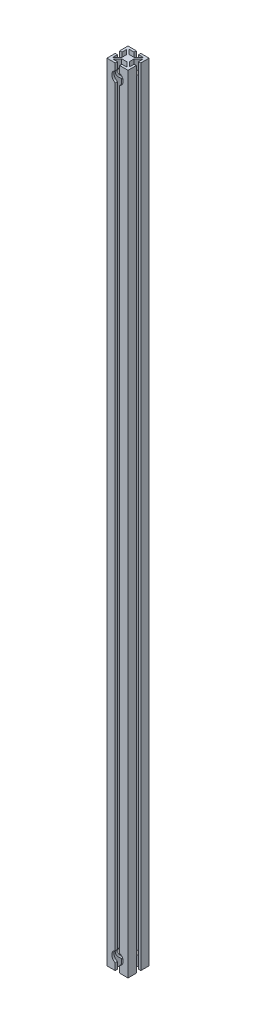
from build123d import *

# Parameters (mm, degrees)
EXTRUDE1_DEPTH          = 1422.4
SKETCH2_R               = 10.3124
CUT_EXTRUDE1_DEPTH      = 16.51
MIRROR2_COPY_1_SKETCH_R = 10.3124
MIRROR2_COPY_1_DEPTH    = 16.51


# Read off the part's stored shape, not the designer's step: 1515<1>
with BuildPart() as part:
    # Sketch1<2> → Extrude1 (new body)
    with BuildSketch(Plane(origin=(0, 0, 0), x_dir=(1, 0, 0), z_dir=(0, 1, 0))):
        Polygon((-6.7564, 4.364749804), (-6.7564, -4.364749804), (-14.986, -12.594349804), (-14.986, -4.064), (-19.05, -4.064), (-19.05, -19.05), (-4.064, -19.05), (-4.064, -14.986), (-13.067127258, -14.986), (-4.837527258, -6.7564), (4.837527258, -6.7564), (13.067127258, -14.986), (4.064, -14.986), (4.064, -19.05), (19.05, -19.05), (19.05, -4.064), (14.986, -4.064), (14.986, -12.594349804), (6.7564, -4.364749804), (6.7564, 4.364749804), (14.986, 12.594349804), (14.986, 4.064), (19.05, 4.064), (19.05, 19.05), (4.064, 19.05), (4.064, 14.986), (13.067127258, 14.986), (4.837527258, 6.7564), (-4.837527258, 6.7564), (-13.067127258, 14.986), (-4.064, 14.986), (-4.064, 19.05), (-19.05, 19.05), (-19.05, 4.064), (-14.986, 4.064), (-14.986, 12.594349804), align=None)
    extrude(amount=EXTRUDE1_DEPTH)

    # Sketch2 → Cut-Extrude1 (cut)
    with BuildSketch(Plane(origin=(0, 0, -19.05), x_dir=(-1, 0, 0), z_dir=(0, 0, -1))):
        with Locations(Location((0, 21.717, 0), (0, 0, 310.932724574))):
            Circle(SKETCH2_R)
    cut_extrude1 = extrude(amount=-CUT_EXTRUDE1_DEPTH, mode=Mode.SUBTRACT)

    # Mirror1: Cut-Extrude1 across plane
    add(cut_extrude1.mirror(Plane.XY), mode=Mode.SUBTRACT)

    # Mirror2: Cut-Extrude1 across plane
    add(cut_extrude1.mirror(Plane(origin=(0, 711.2, 0), x_dir=(0, 0, 1), z_dir=(0, -1, 0))), mode=Mode.SUBTRACT)

    # Mirror2 copy 1 sketch → Mirror2 copy 1 (cut)
    with BuildSketch(Plane(origin=(0, 1422.4, 19.05), x_dir=(-1, 0, 0), z_dir=(0, 0, 1))):
        with Locations(Location((0, 21.717, 0), (0, 0, 310.932724574))):
            Circle(MIRROR2_COPY_1_SKETCH_R)
    extrude(amount=-MIRROR2_COPY_1_DEPTH, mode=Mode.SUBTRACT)


solid = part.part
